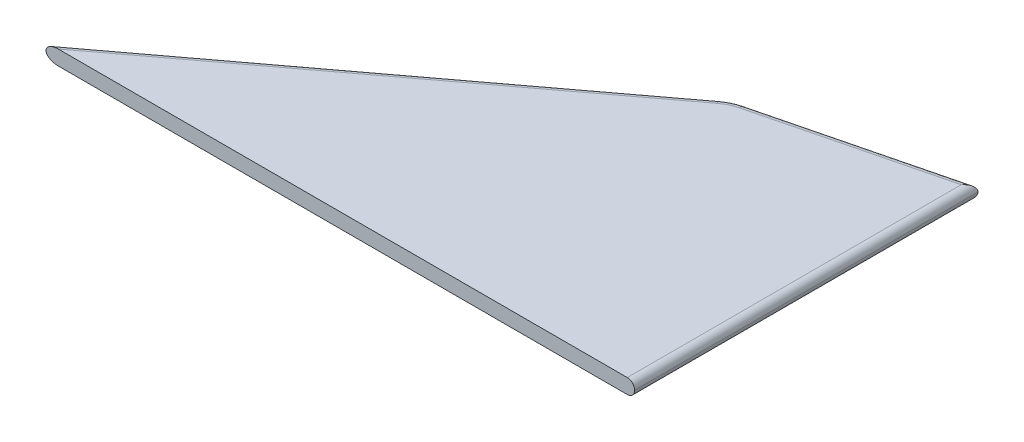
from build123d import *

# Parameters (mm, degrees)
BOSS_EXTRUDE1_DEPTH = 3
FILLET2_R           = 10
FILLET1_R           = 1.5


with BuildPart() as part:
    # Sketch1 → Boss-Extrude1 (new body)
    with BuildSketch(Plane(origin=(0, 0, 0), x_dir=(1, 0, 0), z_dir=(0, 1, 0))):
        Polygon((0, 0), (120, 0), (120, 70), (80, 60), align=None)
    extrude(amount=BOSS_EXTRUDE1_DEPTH)

    # Fillet2
    fillet2_edges = [part.edges().sort_by_distance(p)[0] for p in [
        (80, 1.5, -60),
    ]]
    fillet(fillet2_edges, radius=FILLET2_R)

    # Fillet1
    fillet1_edges = [part.edges().sort_by_distance(p)[0] for p in [
        (120, 3, -35),
        (120, 0, -35),
        (100.979557811, 3, -65.244889453),
        (100.979557811, 0, -65.244889453),
        (39.192235936, 0, -29.394176952),
        (39.192235936, 3, -29.394176952),
        (80.086755182, 0, -59.817729921),
        (80.086755182, 3, -59.817729921),
    ]]
    fillet(fillet1_edges, radius=FILLET1_R - 0.0001)  # a hair under: the kernel refuses the full size


solid = part.part
